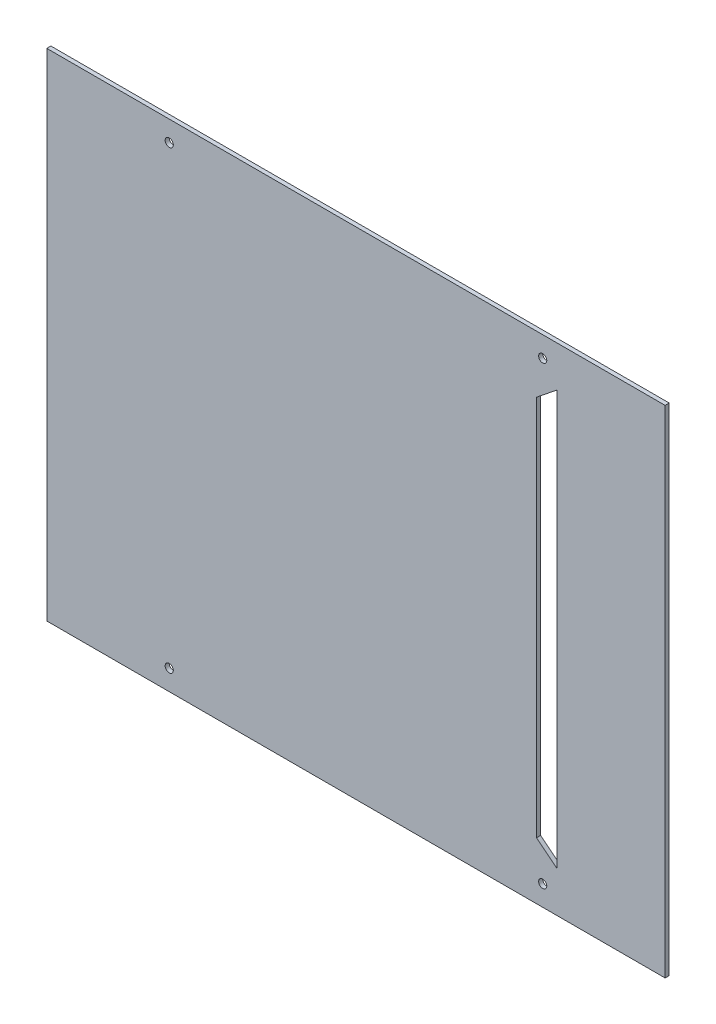
from build123d import *

# Parameters (mm, degrees)
SKETCH1_W           = 303
SKETCH1_H           = 243
SKETCH1_R           = 2
BOSS_EXTRUDE1_DEPTH = 2


with BuildPart() as part:
    # Sketch1 → Boss-Extrude1 (new body)
    with BuildSketch(Plane.XY):
        Rectangle(SKETCH1_W, SKETCH1_H)
        with Locations((-91.5, 111.5)):
            Circle(SKETCH1_R, mode=Mode.SUBTRACT)
        with Locations((91.5, 111.5)):
            Circle(SKETCH1_R, mode=Mode.SUBTRACT)
        with Locations((91.5, -111.5)):
            Circle(SKETCH1_R, mode=Mode.SUBTRACT)
        with Locations((-91.5, -111.5)):
            Circle(SKETCH1_R, mode=Mode.SUBTRACT)
        Polygon((98.5, 101.5), (98.5, -101.5), (88.5, -93.48019802), (88.5, 93.48019802), align=None, mode=Mode.SUBTRACT)
    extrude(amount=BOSS_EXTRUDE1_DEPTH)


solid = part.part
